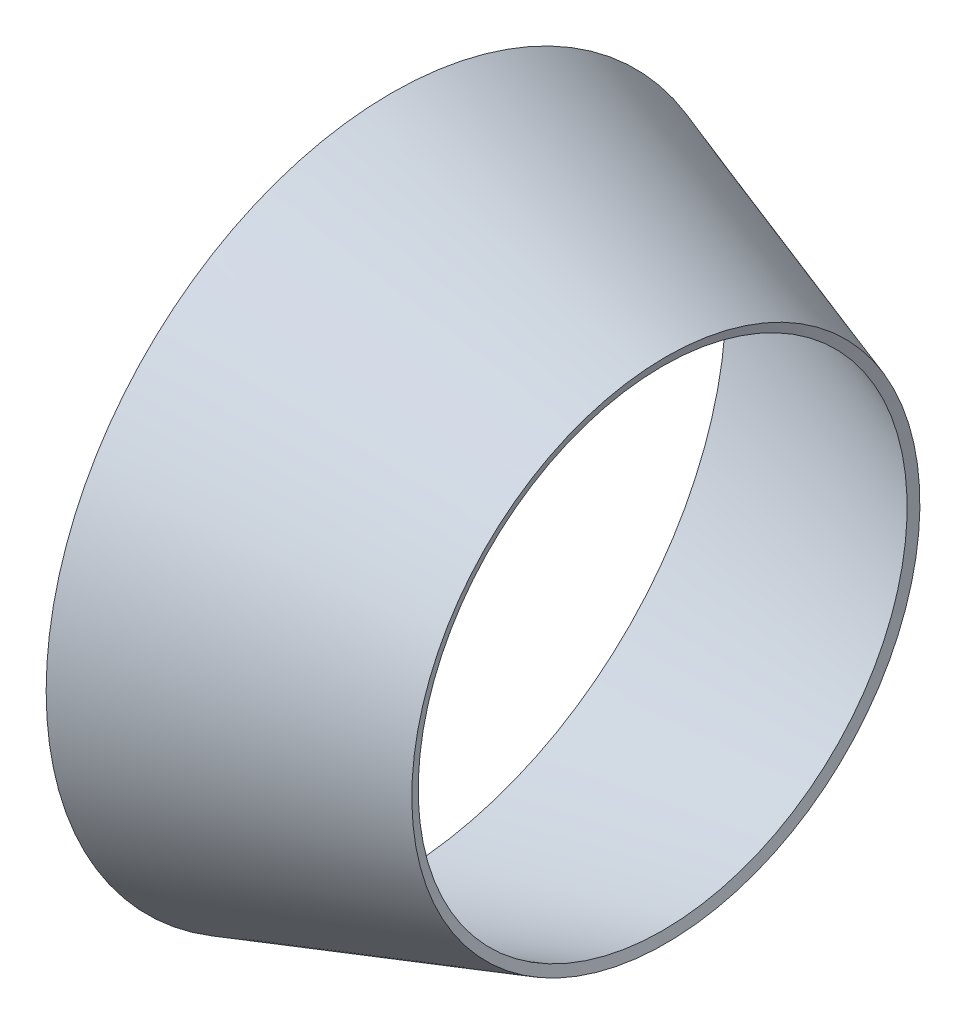
from build123d import *


with BuildPart() as part:
    # Sketch1 → Revolve1 (revolve)
    with BuildSketch(Plane.XY):
        Polygon((-42.091303455, -43.423295454), (-7.57637431, -31.950259451), (-7.976979694, -30.7450975), (-42.091303455, -42.084969099), align=None)
    revolve(axis=Axis((0, 0, 0), (-1, 0, 0)))


solid = part.part
